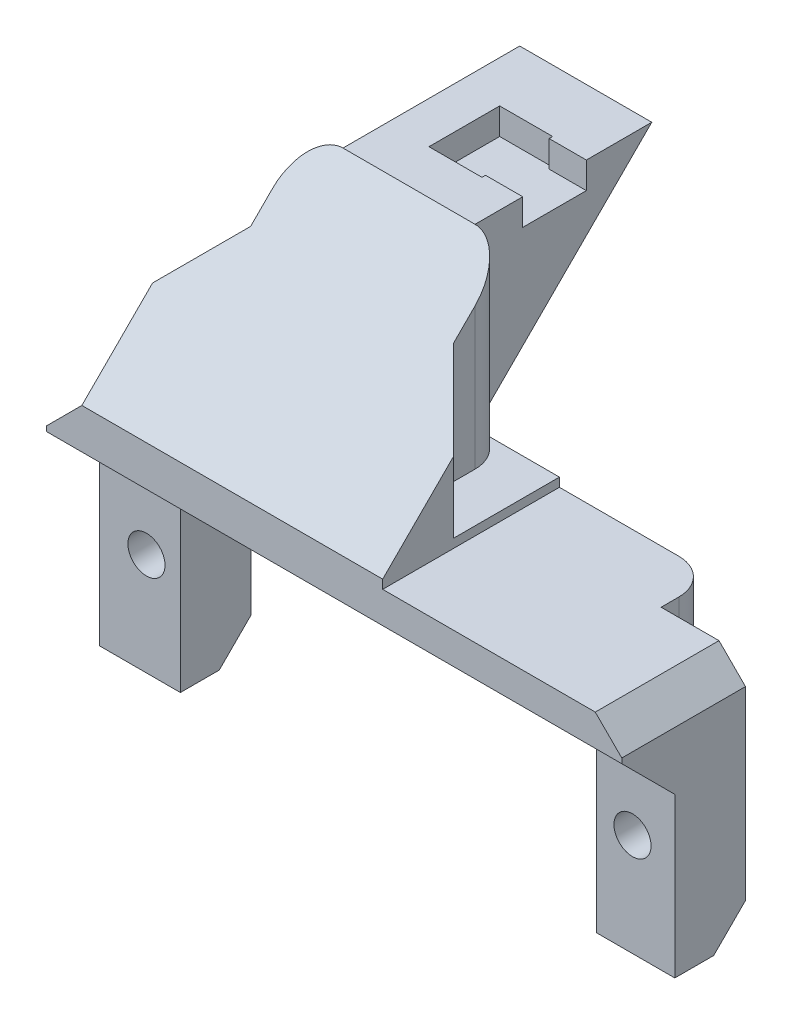
from build123d import *

# Parameters (mm, degrees)
SKETCH1_W             = 23
SKETCH1_H             = 10
BOSS_EXTRUDE1_DEPTH   = 3
SKETCH2_W             = 7
SKETCH2_H             = 3
BOSS_EXTRUDE2_DEPTH   = 4.775
SKETCH3_W             = 7
SKETCH3_H             = 3
BOSS_EXTRUDE3_DEPTH   = 4.775
BOSS_EXTRUDE4_START   = -4.775
BOSS_EXTRUDE4_DEPTH   = 4.775
BOSS_EXTRUDE4_START_2 = 23.130914758
BOSS_EXTRUDE4_2_DEPTH = 4.644085242
SKETCH5_W             = 6.593837141
SKETCH5_H             = 7.601131285
CUT_EXTRUDE1_DEPTH    = 94
CUT_EXTRUDE2_DEPTH    = 94
SKETCH7_R             = 1.05
CUT_EXTRUDE3_DEPTH    = 94
FILLET1_R             = 2
CHAMFER2_SIZE         = 2
CHAMFER3_SIZE         = 2
BOSS_EXTRUDE5_START   = 10
SKETCH8_W             = 3.735996303
SKETCH8_H             = 10
BOSS_EXTRUDE5_DEPTH   = 10
SKETCH10_W            = 1.630996303
SKETCH10_H            = 4
SKETCH10_W_2          = 0.412454303
SKETCH10_H_2          = 2
CUT_EXTRUDE5_DEPTH    = 1.5
SKETCH11_W            = 2.105
SKETCH11_H            = 3.6
CUT_EXTRUDE6_DEPTH    = 1.5
SKETCH14_W            = 12.528007394
SKETCH14_H            = 0.5
CUT_EXTRUDE9_DEPTH    = 14
CHAMFER4_SIZE         = 10
CHAMFER5_SIZE         = 10
CHAMFER6_SIZE         = 3
SKETCH12_W            = 32.55
SKETCH12_H            = 6
CUT_EXTRUDE7_DEPTH    = 3
SKETCH13_W            = 32.55
SKETCH13_H            = 3
CUT_EXTRUDE8_DEPTH    = 3
CHAMFER7_SIZE         = 3


# Read off the part's stored shape, not the designer's step: Boss-Extrude4
# Some blends are built 0.0001 mm under size
with BuildPart() as part:
    # Sketch1 → Boss-Extrude1 (new body)
    with BuildSketch(Plane(origin=(0, 0, 0), x_dir=(1, 0, 0), z_dir=(0, 1, 0))):
        with Locations((11.5, 5)):
            Rectangle(SKETCH1_W, SKETCH1_H)
    extrude(amount=BOSS_EXTRUDE1_DEPTH)

    # Sketch2 → Boss-Extrude2 (add)
    with BuildSketch(Plane(origin=(23, 0, 0), x_dir=(0, 0, -1), z_dir=(1, 0, 0))):
        with Locations((3.5, 1.5)):
            Rectangle(SKETCH2_W, SKETCH2_H)
    extrude(amount=BOSS_EXTRUDE2_DEPTH)

    # Sketch3 → Boss-Extrude3 (add)
    with BuildSketch(Plane.ZY):
        with Locations((-3.5, 1.5)):
            Rectangle(SKETCH3_W, SKETCH3_H)
    extrude(amount=BOSS_EXTRUDE3_DEPTH)

    # Boss-Extrude4 outline → Boss-Extrude4 (add)
    with BuildSketch(Plane.YZ.offset(BOSS_EXTRUDE4_START)):
        Polygon((0, 0), (-16.48071009, 0), (-9.48071009, -7), (0, -7), align=None)
    extrude(amount=BOSS_EXTRUDE4_DEPTH)

    # Boss-Extrude4 2 outline → Boss-Extrude4 2 (add)
    with BuildSketch(Plane.YZ.offset(BOSS_EXTRUDE4_START_2)):
        Polygon((0, 0), (-16.48071009, 0), (-9.48071009, -7), (0, -7), align=None)
    extrude(amount=BOSS_EXTRUDE4_2_DEPTH)

    # Sketch5 → Cut-Extrude1 (cut)
    with BuildSketch(Plane.ZY.offset(4.775)):
        with Locations((-3.296918571, -15.081275732)):
            Rectangle(SKETCH5_W, SKETCH5_H)
    extrude(amount=-CUT_EXTRUDE1_DEPTH, mode=Mode.SUBTRACT)

    # Sketch6 → Cut-Extrude2 (cut)
    with BuildSketch(Plane.XY):
        Polygon((23.330914758, 0.2), (-0.2, 0.2), (-0.2, -11.28071009), (0, -11.28071009), (0, 0), (23.130914758, 0), (23.130914758, -11.28071009), (23.330914758, -11.28071009), align=None)
    extrude(amount=-CUT_EXTRUDE2_DEPTH, mode=Mode.SUBTRACT)

    # Sketch7 → Cut-Extrude3 (cut)
    with BuildSketch(Plane(origin=(0, 0, -7), x_dir=(-1, 0, 0), z_dir=(0, 0, -1))):
        with Locations((2.119085242, -5.48071009)):
            Circle(SKETCH7_R)
        with Locations((-25.380914758, -5.48071009)):
            Circle(SKETCH7_R)
    extrude(amount=-CUT_EXTRUDE3_DEPTH, mode=Mode.SUBTRACT)

    # Fillet1
    fillet1_edges = [part.edges().sort_by_distance(p)[0] for p in [
        (0, 1.6, -10),
        (23, 1.6, -10),
    ]]
    fillet(fillet1_edges, radius=FILLET1_R)

    # Chamfer2
    chamfer2_edges = [part.edges().sort_by_distance(p)[0] for p in [
        (27.775, 3, -3.5),
        (-4.775, 3, -3.5),
    ]]
    chamfer(chamfer2_edges, length=CHAMFER2_SIZE)

    # Chamfer3
    chamfer3_edges = [part.edges().sort_by_distance(p)[0] for p in [
        (25.552957379, -11.28071009, 0),
    ]]
    chamfer(chamfer3_edges, length=CHAMFER3_SIZE)

    # Sketch8 → Boss-Extrude5 (add)
    with BuildSketch(Plane(origin=(0, 3, 0), x_dir=(1, 0, 0), z_dir=(0, 1, 0)).offset(BOSS_EXTRUDE5_START)):
        with BuildLine():
            Line((9.471992606, 10), (5.735996303, 10))
            Line((5.735996303, 10), (5.735996303, 0))
            Line((5.735996303, 0), (14.246992606, 0))
            Line((14.246992606, 0), (14.246992606, 7))
            Line((14.246992606, 7), (11.471992606, 7))
            Line((11.471992606, 7), (11.471992606, 8))
            ThreePointArc((11.471992606, 8), (10.886206168, 9.414213562), (9.471992606, 10))
        make_face()
        with BuildLine():
            Line((5.735996303, 0), (5.735996303, 10))
            Line((5.735996303, 10), (2, 10))
            ThreePointArc((2, 10), (0.585786438, 9.414213562), (0, 8))
            Line((0, 8), (0, 7))
            Line((0, 7), (-2.775, 7))
            Line((-2.775, 7), (-2.775, 0))
            Line((-2.775, 0), (5.735996303, 0))
        make_face()
        with Locations((3.867998152, 15)):
            Rectangle(SKETCH8_W, SKETCH8_H)
        with Locations((7.603994455, 15)):
            Rectangle(SKETCH8_W, SKETCH8_H)
    extrude(amount=-BOSS_EXTRUDE5_DEPTH)

    # Sketch10 → Cut-Extrude5 (cut)
    with BuildSketch(Plane(origin=(0, 13, 0), x_dir=(1, 0, 0), z_dir=(0, 1, 0))):
        with Locations((6.551494455, 14.49800095)):
            Rectangle(SKETCH10_W, SKETCH10_H)
        with Locations((4.573219758, 13.49800095)):
            Rectangle(SKETCH10_W_2, SKETCH10_H_2)
        with Locations((4.573219758, 15.49800095)):
            Rectangle(SKETCH10_W_2, SKETCH10_H_2)
        Polygon((5.735996303, 16.49800095), (4.779446909, 16.49800095), (4.779446909, 14.49800095), (4.779446909, 12.49800095), (5.735996303, 12.49800095), align=None)
    extrude(amount=-CUT_EXTRUDE5_DEPTH, mode=Mode.SUBTRACT)

    # Sketch11 → Cut-Extrude6 (cut)
    with BuildSketch(Plane(origin=(0, 13, 0), x_dir=(1, 0, 0), z_dir=(0, 1, 0))):
        with Locations((8.419492606, 14.49800095)):
            Rectangle(SKETCH11_W, SKETCH11_H)
    extrude(amount=-CUT_EXTRUDE6_DEPTH, mode=Mode.SUBTRACT)

    # Sketch14 → Cut-Extrude9 (cut)
    with BuildSketch(Plane.XY):
        with Locations((20.510996303, 2.75)):
            Rectangle(SKETCH14_W, SKETCH14_H)
    extrude(amount=-CUT_EXTRUDE9_DEPTH, mode=Mode.SUBTRACT)

    # Chamfer4
    chamfer4_edges = [part.edges().sort_by_distance(p)[0] for p in [
        (5.735996303, 3, -20),
    ]]
    chamfer(chamfer4_edges, length=CHAMFER4_SIZE - 0.0001)  # a hair under: the kernel refuses the full size

    # Chamfer5
    chamfer5_edges = [part.edges().sort_by_distance(p)[0] for p in [
        (5.735996303, 13, 0),
    ]]
    chamfer(chamfer5_edges, length=CHAMFER5_SIZE)

    # Chamfer6
    # the kernel refuses this chamfer: 3 mm, written as the material it takes off along each edge
    with BuildSketch(Plane(origin=(-2.775, 17.715048964, -7), x_dir=(0.9996219169112968, 0, -0.02749587661058649), z_dir=(0, -1, 0))) as chamfer6_piece_1_section:
        Polygon((CHAMFER6_SIZE * 0.999621916911, CHAMFER6_SIZE * 0.0274958766106), (-CHAMFER6_SIZE * 0.0274958766106, CHAMFER6_SIZE * 0.999621916911), (0, 0), align=None)
    chamfer6_piece_1 = extrude(amount=22.430097928, mode=Mode.PRIVATE)
    chamfer6_piece_1 = split(chamfer6_piece_1, bisect_by=Plane(origin=(0, 7.74942321, -6.834490118), z_dir=(-1, 0, 0)), keep=Keep.TOP, mode=Mode.PRIVATE)
    chamfer6_piece_1 = split(chamfer6_piece_1, bisect_by=Plane(origin=(0.931889756, 6.706889756, -6.834490118), z_dir=(-0.7071067811865476, 0.7071067811865476, 0)), keep=Keep.TOP, mode=Mode.PRIVATE)
    add(chamfer6_piece_1, mode=Mode.SUBTRACT)
    with BuildSketch(Plane(origin=(14.246992606, 17.715048964, -7), x_dir=(-0.9996219169112969, 0, -0.027495876610586497), z_dir=(0, -1, 0))) as chamfer6_piece_2_section:
        Polygon((CHAMFER6_SIZE * 0.999621916911, -CHAMFER6_SIZE * 0.0274958766106), (-CHAMFER6_SIZE * 0.0274958766106, -CHAMFER6_SIZE * 0.999621916911), (0, 0), align=None)
    chamfer6_piece_2 = extrude(amount=14.715048964, mode=Mode.PRIVATE)
    chamfer6_piece_2 = split(chamfer6_piece_2, bisect_by=Plane(origin=(11.471992606, 6.038915357, -6.077830715), z_dir=(1, 0, 0)), keep=Keep.TOP, mode=Mode.PRIVATE)
    add(chamfer6_piece_2, mode=Mode.SUBTRACT)

    # Sketch12 → Cut-Extrude7 (cut)
    with BuildSketch(Plane.XY):
        with Locations((11.5, -5.28071009)):
            Rectangle(SKETCH12_W, SKETCH12_H)
    extrude(amount=-CUT_EXTRUDE7_DEPTH, mode=Mode.SUBTRACT)

    # Sketch13 → Cut-Extrude8 (cut)
    with BuildSketch(Plane(origin=(0, -8.28071009, 0), x_dir=(1, 0, 0), z_dir=(0, 1, 0))):
        with Locations((11.5, 1.5)):
            Rectangle(SKETCH13_W, SKETCH13_H)
    extrude(amount=-CUT_EXTRUDE8_DEPTH, mode=Mode.SUBTRACT)

    # Chamfer7
    chamfer7_edges = [part.edges().sort_by_distance(p)[0] for p in [
        (25.552957379, -2.28071009, 0),
    ]]
    chamfer(chamfer7_edges, length=CHAMFER7_SIZE - 0.0001)  # a hair under: the kernel refuses the full size


solid = part.part
